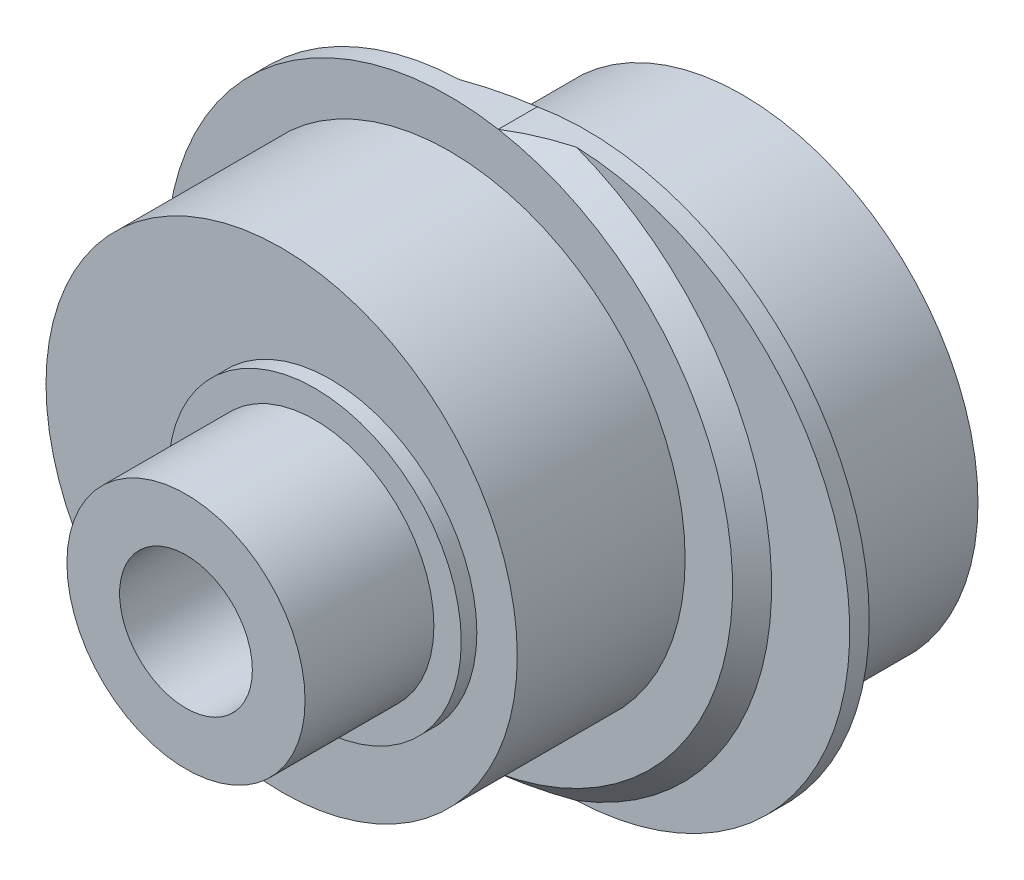
from build123d import *

# Parameters (mm, degrees)
EXTRUDE_START           = -0.5
EXTRUDE_1_OUTLINE_R     = 6.035
EXTRUDE_1_DEPTH         = 4.8
EXTRUDE_START_2         = 4
EXTRUDE_1_2_DEPTH       = 1
SKETCH_2_R              = 6.035
EXTRUDE_2_DEPTH         = 4
HOLE_WIZARD_3_4_3_4_1_D = 3.4
CUT_EXTRUDE_1_DEPTH     = 8.5


with BuildPart() as part:
    # 凸台-拉伸1: read off the stored shape, not the designer's step
    # 凸台-拉伸1 outline → 凸台-拉伸1 (new body)
    with BuildSketch(Plane.XY.offset(5).offset(EXTRUDE_START)):
        with Locations((-1.25, 0)):
            Circle(EXTRUDE_1_OUTLINE_R)
    extrude(amount=EXTRUDE_1_DEPTH)

    # Extrude 1 2 outline → Extrude 1 2 (add)
    with BuildSketch(Plane.XY.offset(EXTRUDE_START_2)):
        with BuildLine():
            ThreePointArc((0, -7.141428429), (8.5, 0), (0, 7.141428429))
            ThreePointArc((0, 7.141428429), (-8.5, 0), (0, -7.141428429))
        make_face()
    extrude(amount=EXTRUDE_1_2_DEPTH)

    # Extrude 1 3 outline → Extrude 1 3 (revolve, cut)
    with BuildSketch(Plane(origin=(-1.25, 0, 0), x_dir=(1, 0, 0), z_dir=(0, -1, 0))):
        Polygon((7.25, 5), (7.75, 4.5), (9.75, 4.5), (9.75, 5), align=None)
    revolve(axis=Axis((-1.25, 0, 0), (0, 0, 1)), mode=Mode.SUBTRACT)

    # Extrude 1 4 outline → Extrude 1 4 (revolve, cut)
    with BuildSketch(Plane(origin=(1.25, 0, 0), x_dir=(1, 0, 0), z_dir=(0, -1, 0))):
        Polygon((9.75, 4.5), (7.75, 4.5), (7.25, 4), (9.75, 4), align=None)
    revolve(axis=Axis((1.25, 0, 0), (0, 0, 1)), mode=Mode.SUBTRACT)

    # 草图2 → 凸台-拉伸2 (add)
    with BuildSketch(Plane(origin=(0, 0, 4), x_dir=(-1, 0, 0), z_dir=(0, 0, -1))):
        with Locations(Location((-1.25, 0, 0), (0, 0, 180))):
            Circle(SKETCH_2_R)
    extrude(amount=EXTRUDE_2_DEPTH)

    # 草图5 → 旋转1 (revolve)
    with BuildSketch(Plane.XZ, mode=Mode.PRIVATE) as revolve_1_sk:
        Polygon((3.05, 13), (0, 13), (0, 9), (3.75, 9), (3.75, 9.7), (3.05, 9.7), align=None)
    revolve(revolve_1_sk.sketch.rotate(Axis((0, 0, 13), (0, 0, -1)), 180), axis=Axis((0, 0, 13), (0, 0, -1)))

    # Ø3.4 (3.4) 直径孔1 (through all)
    with Locations(Plane.XY.offset(13)):
        with Locations((0, 0)):
            Hole(HOLE_WIZARD_3_4_3_4_1_D / 2)

    # 草图8 → 切除-拉伸1 (cut)
    with BuildSketch(Plane(origin=(0, 0, 0), x_dir=(-1, 0, 0), z_dir=(0, 0, -1))):
        with BuildLine():
            Line((-2.55, 3.05), (2.55, 3.05))
            ThreePointArc((2.55, 3.05), (2.903553391, 2.903553391), (3.05, 2.55))
            Line((3.05, 2.55), (3.05, -2.55))
            ThreePointArc((3.05, -2.55), (2.903553391, -2.903553391), (2.55, -3.05))
            Line((2.55, -3.05), (-2.55, -3.05))
            ThreePointArc((-2.55, -3.05), (-2.903553391, -2.903553391), (-3.05, -2.55))
            Line((-3.05, -2.55), (-3.05, 2.55))
            ThreePointArc((-3.05, 2.55), (-2.903553391, 2.903553391), (-2.55, 3.05))
        make_face()
    extrude(amount=-CUT_EXTRUDE_1_DEPTH, mode=Mode.SUBTRACT)


solid = part.part
